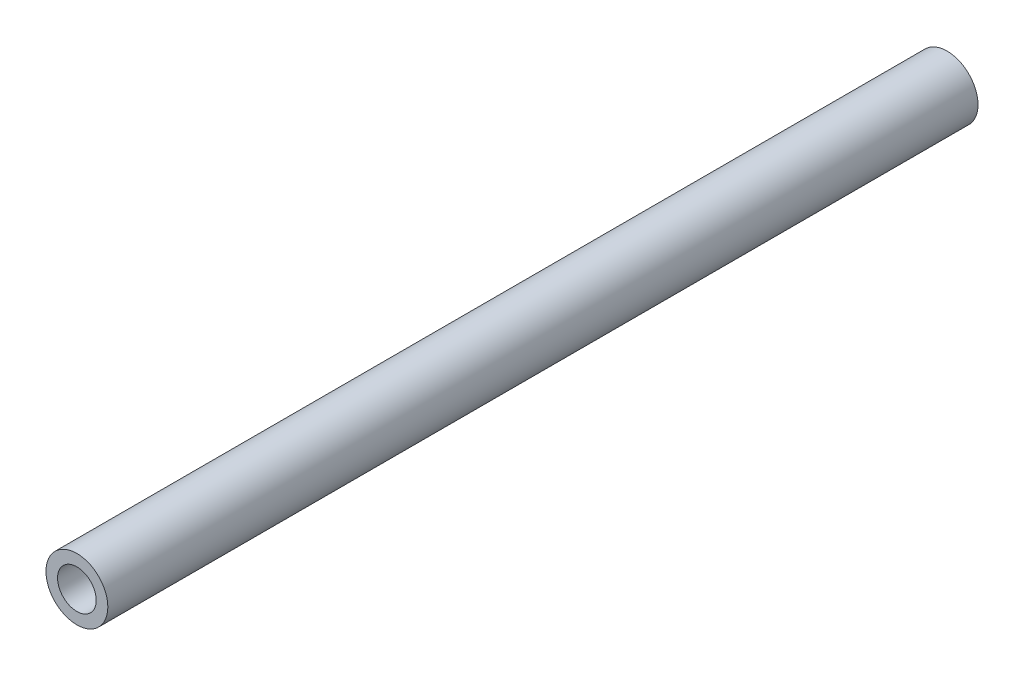
from build123d import *

# Parameters (mm, degrees)
SZKIC1_R                    = 8
SZKIC1_R_2                  = 4
DODANIE_WYCI_GNI_CIE1_DEPTH = 112.5
SZKIC2_R                    = 5
WYTNIJ_WYCI_GNI_CIE1_DEPTH  = 40
WYTNIJ_WYCI_GNI_CIE2_START  = -30
SZKIC3_R                    = 5
WYTNIJ_WYCI_GNI_CIE2_DEPTH  = 30


with BuildPart() as part:
    # Szkic1 → Dodanie-wyciągnięcie1 (new, symmetric)
    with BuildSketch(Plane.XY):
        Circle(SZKIC1_R)
        Circle(SZKIC1_R_2, mode=Mode.SUBTRACT)
    extrude(amount=DODANIE_WYCI_GNI_CIE1_DEPTH, both=True)

    # Szkic2 → Wytnij-wyciągnięcie1 (cut)
    with BuildSketch(Plane.XY.offset(112.5)):
        Circle(SZKIC2_R)
    extrude(amount=-WYTNIJ_WYCI_GNI_CIE1_DEPTH, mode=Mode.SUBTRACT)

    # Szkic3 → Wytnij-wyciągnięcie2 (cut)
    with BuildSketch(Plane(origin=(0, 0, -112.5), x_dir=(-1, 0, 0), z_dir=(0, 0, -1)).offset(WYTNIJ_WYCI_GNI_CIE2_START)):
        Circle(SZKIC3_R)
    extrude(amount=WYTNIJ_WYCI_GNI_CIE2_DEPTH, mode=Mode.SUBTRACT)


solid = part.part
